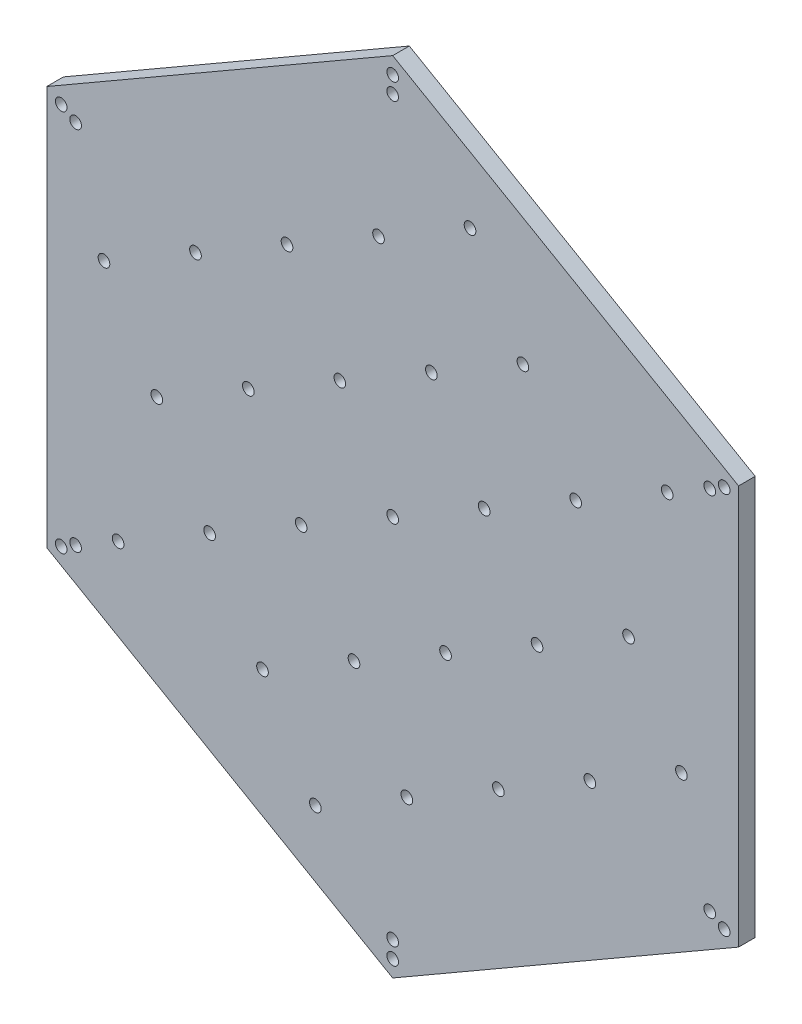
from build123d import *

# Parameters (mm, degrees)
BOSS_EXTRUDE1_DEPTH     = 5
SKETCH2_R               = 1.75
CUT_EXTRUDE1_DEPTH      = 5
SKETCH3_R               = 1.75
CUT_EXTRUDE2_DEPTH      = 159.823801743
FILL_PATTERN1_OUTLINE_R = 1.75
FILL_PATTERN1_DEPTH     = 5


# Read off the part's stored shape, not the designer's step: Fill Pattern1
with BuildPart() as part:
    # Sketch1 → Boss-Extrude1 (new body)
    with BuildSketch(Plane.XY):
        Polygon((103.923048454, -60), (103.923048454, 60), (0, 120), (-103.923048454, 60), (-103.923048454, -60), (0, -120), align=None)
    extrude(amount=BOSS_EXTRUDE1_DEPTH)

    # Sketch2 → Cut-Extrude1 (cut)
    with BuildSketch(Plane.XY.offset(5)):
        with Locations((-99.592921435, 57.5)):
            Circle(SKETCH2_R)
        with Locations((-95.262794416, 55)):
            Circle(SKETCH2_R)
        with Locations(Location((95.262794416, 55, 0), (0, 0, 180))):
            Circle(SKETCH2_R)
        with Locations(Location((99.592921435, 57.5, 0), (0, 0, 180))):
            Circle(SKETCH2_R)
        with Locations((99.592921435, -57.5)):
            Circle(SKETCH2_R)
        with Locations((95.262794416, -55)):
            Circle(SKETCH2_R)
        with Locations(Location((-95.262794416, -55, 0), (0, 0, 180))):
            Circle(SKETCH2_R)
        with Locations(Location((-99.592921435, -57.5, 0), (0, 0, 180))):
            Circle(SKETCH2_R)
        with Locations((0, -115)):
            Circle(SKETCH2_R)
        with Locations((0, -110)):
            Circle(SKETCH2_R)
        with Locations(Location((0, 115, 0), (0, 0, 180))):
            Circle(SKETCH2_R)
        with Locations(Location((0, 110, 0), (0, 0, 180))):
            Circle(SKETCH2_R)
    extrude(amount=-CUT_EXTRUDE1_DEPTH, mode=Mode.SUBTRACT)

    # Sketch3 → Cut-Extrude2 (cut, through all)
    with BuildSketch(Plane.XY.offset(5)):
        Circle(SKETCH3_R)
    extrude(amount=-CUT_EXTRUDE2_DEPTH, mode=Mode.SUBTRACT)

    # Fill Pattern1 outline → Fill Pattern1 (cut)
    with BuildSketch(Plane.XY):
        with Locations((-27.49545417, -15.874507866)):
            Circle(FILL_PATTERN1_OUTLINE_R)
        with Locations((-54.990908339, -31.749015733)):
            Circle(FILL_PATTERN1_OUTLINE_R)
        with Locations((-82.486362509, -47.623523599)):
            Circle(FILL_PATTERN1_OUTLINE_R)
        with Locations((70.865416206, 4.253561563)):
            Circle(FILL_PATTERN1_OUTLINE_R)
        with Locations((-70.865416206, -4.253561563)):
            Circle(FILL_PATTERN1_OUTLINE_R)
        with Locations((82.486362509, 47.623523599)):
            Circle(FILL_PATTERN1_OUTLINE_R)
        with Locations((54.990908339, 31.749015733)):
            Circle(FILL_PATTERN1_OUTLINE_R)
        with Locations((27.49545417, 15.874507866)):
            Circle(FILL_PATTERN1_OUTLINE_R)
        with Locations((4.253561563, -70.865416206)):
            Circle(FILL_PATTERN1_OUTLINE_R)
        with Locations((31.749015733, -54.990908339)):
            Circle(FILL_PATTERN1_OUTLINE_R)
        with Locations((59.244469903, -39.116400473)):
            Circle(FILL_PATTERN1_OUTLINE_R)
        with Locations((86.739924072, -23.241892607)):
            Circle(FILL_PATTERN1_OUTLINE_R)
        with Locations((-39.116400473, -59.244469903)):
            Circle(FILL_PATTERN1_OUTLINE_R)
        with Locations((-11.620946303, -43.369962036)):
            Circle(FILL_PATTERN1_OUTLINE_R)
        with Locations((15.874507866, -27.49545417)):
            Circle(FILL_PATTERN1_OUTLINE_R)
        with Locations((43.369962036, -11.620946303)):
            Circle(FILL_PATTERN1_OUTLINE_R)
        with Locations((-4.253561563, 70.865416206)):
            Circle(FILL_PATTERN1_OUTLINE_R)
        with Locations((-31.749015733, 54.990908339)):
            Circle(FILL_PATTERN1_OUTLINE_R)
        with Locations((-59.244469903, 39.116400473)):
            Circle(FILL_PATTERN1_OUTLINE_R)
        with Locations((-86.739924072, 23.241892607)):
            Circle(FILL_PATTERN1_OUTLINE_R)
        with Locations((39.116400473, 59.244469903)):
            Circle(FILL_PATTERN1_OUTLINE_R)
        with Locations((11.620946303, 43.369962036)):
            Circle(FILL_PATTERN1_OUTLINE_R)
        with Locations((-15.874507866, 27.49545417)):
            Circle(FILL_PATTERN1_OUTLINE_R)
        with Locations((-43.369962036, 11.620946303)):
            Circle(FILL_PATTERN1_OUTLINE_R)
        with Locations((23.241892607, 86.739924072)):
            Circle(FILL_PATTERN1_OUTLINE_R)
        with Locations((-23.241892607, -86.739924072)):
            Circle(FILL_PATTERN1_OUTLINE_R)
    extrude(amount=FILL_PATTERN1_DEPTH, mode=Mode.SUBTRACT)


solid = part.part
